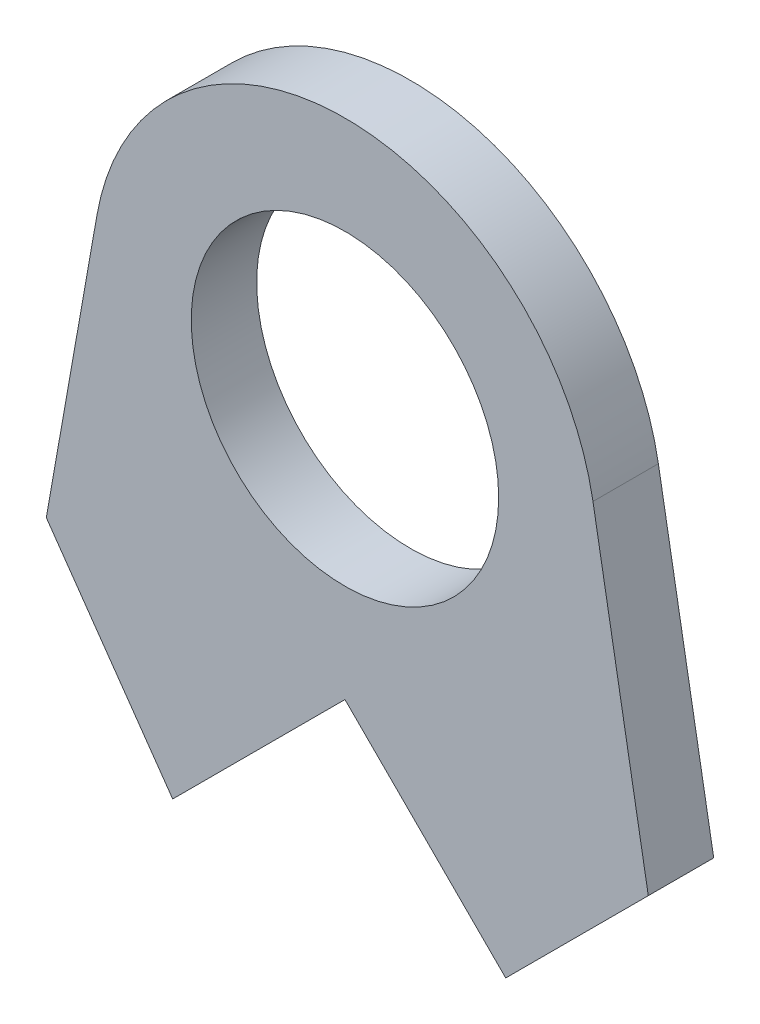
from build123d import *

# Parameters (mm, degrees)
ESQUISSE1_R        = 23.5
BOSS_EXTRU_1_DEPTH = 10
CHANFREIN1_SIZE    = 25.8965397
CHANFREIN1_SIZE_2  = 30


with BuildPart() as part:
    # Esquisse1 → Boss.-Extru.1 (new body)
    with BuildSketch(Plane.XY):
        with BuildLine():
            Line((85, 226.846291066), (56.715728753, 198.562019819))
            Line((56.715728753, 198.562019819), (34.130206535, 198.562019819))
            Line((34.130206535, 198.562019819), (47.084901509, 272.031745907))
            ThreePointArc((47.084901509, 272.031745907), (85, 303.846291066), (122.915098491, 272.031745907))
            Line((122.915098491, 272.031745907), (135.869793465, 198.562019819))
            Line((135.869793465, 198.562019819), (113.284271247, 198.562019819))
            Line((113.284271247, 198.562019819), (85, 226.846291066))
        make_face()
        with Locations((85, 265.346291066)):
            Circle(ESQUISSE1_R, mode=Mode.SUBTRACT)
    extrude(amount=BOSS_EXTRU_1_DEPTH)

    # Chanfrein1
    # the kernel refuses this chamfer: 30, 25.8965397 mm, written as the material it takes off along each edge
    with BuildSketch(Plane(origin=(34.130206535, 198.562019819, -77.150489639), x_dir=(0.9993171132668053, -0.036950062680586405, 0), z_dir=(0, 0, 1)), Plane(origin=(135.869793465, 198.562019819, -77.150489639), x_dir=(-0.13714088742803301, 0.9905515519120909, 0), z_dir=(0, 0, 1))) as chanfrein1_piece_1:
        Polygon((CHANFREIN1_SIZE * 0.999317113282, CHANFREIN1_SIZE * 0.0369500626812), (CHANFREIN1_SIZE_2 * 0.137140887428, CHANFREIN1_SIZE_2 * 0.990551551912), (0, 0), align=None)
    extrude(amount=164.300979278, mode=Mode.SUBTRACT)


solid = part.part
